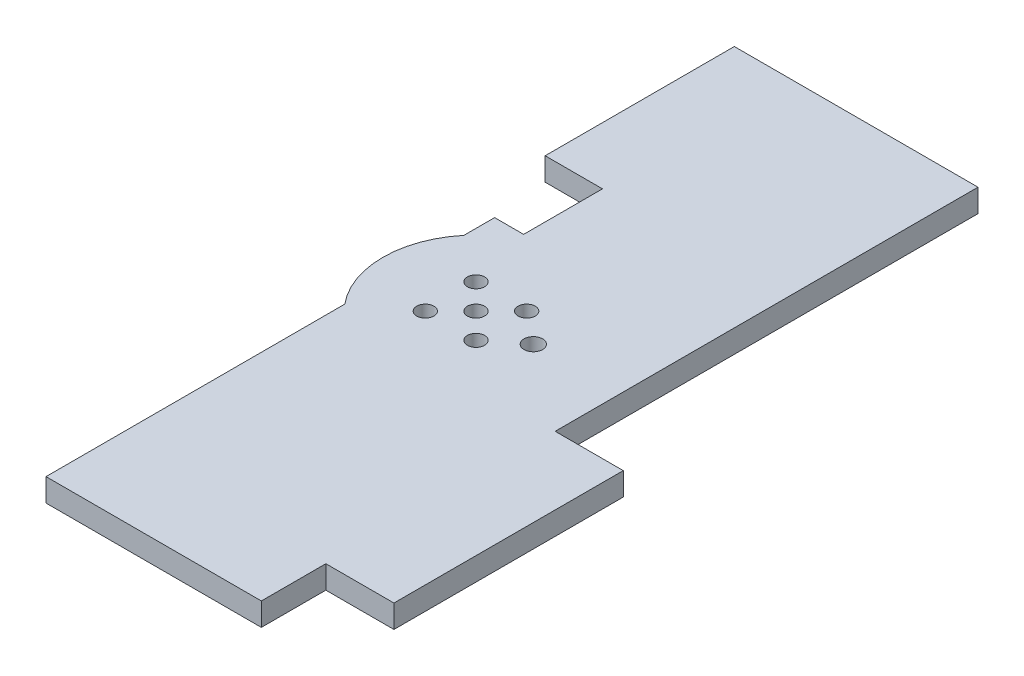
from build123d import *

# Parameters (mm, degrees)
BOSS_EXTRUDE1_DEPTH      = 1.6
M12_MOUNTING_HOLES_REACH = 33.9
SKETCH3_R                = 0.6
SKETCH3_R_2              = 0.65


with BuildPart() as part:
    # Sketch1 → Boss-Extrude1 (new body)
    with BuildSketch(Plane(origin=(0, 0, 0), x_dir=(1, 0, 0), z_dir=(0, 1, 0))):
        with BuildLine():
            Line((0, 25), (15, 25))
            Line((15, 25), (15, -4.499993736))
            Line((15, -4.499993736), (19.75, -4.499993736))
            Line((19.75, -4.499993736), (19.75, -20.499993736))
            Line((19.75, -20.499993736), (15, -20.499993736))
            Line((15, -20.499993736), (15, -24.999993736))
            Line((15, -24.999993736), (-0.025028863, -24.999993736))
            Line((-0.025028863, -24.999993736), (-0.025028863, -4.153311931))
            ThreePointArc((-0.025028863, -4.153311931), (-1.525028863, 0), (-0.025028863, 4.153311931))
            Line((-0.025028863, 4.153311931), (-0.025028863, 6.3))
            Line((-0.025028863, 6.3), (2, 6.3))
            Line((2, 6.3), (2, 11.8))
            Line((2, 11.8), (-2, 11.8))
            Line((-2, 11.8), (-2, 25))
            Line((-2, 25), (0, 25))
        make_face()
    extrude(amount=BOSS_EXTRUDE1_DEPTH)

    # Sketch3 → M12 mounting holes (cut, up to next)
    with BuildSketch(Plane(origin=(0, 1.6, 0), x_dir=(1, 0, 0), z_dir=(0, 1, 0)), mode=Mode.PRIVATE) as m12_mounting_holes_sk1:
        with Locations((4.974971137, 0)):
            Circle(SKETCH3_R)
    m12_mounting_holes_tool1 = extrude(m12_mounting_holes_sk1.sketch, amount=-M12_MOUNTING_HOLES_REACH, mode=Mode.PRIVATE) & part.part
    # Sketch3 → M12 mounting holes (cut, up to next)
    with BuildSketch(Plane(origin=(0, 1.6, 0), x_dir=(1, 0, 0), z_dir=(0, 1, 0)), mode=Mode.PRIVATE) as m12_mounting_holes_sk2:
        with Locations((3.207204184, 1.767766953)):
            Circle(SKETCH3_R)
    m12_mounting_holes_tool2 = extrude(m12_mounting_holes_sk2.sketch, amount=-M12_MOUNTING_HOLES_REACH, mode=Mode.PRIVATE) & part.part
    # Sketch3 → M12 mounting holes (cut, up to next)
    with BuildSketch(Plane(origin=(0, 1.6, 0), x_dir=(1, 0, 0), z_dir=(0, 1, 0)), mode=Mode.PRIVATE) as m12_mounting_holes_sk3:
        with Locations((6.74273809, 1.767766953)):
            Circle(SKETCH3_R)
    m12_mounting_holes_tool3 = extrude(m12_mounting_holes_sk3.sketch, amount=-M12_MOUNTING_HOLES_REACH, mode=Mode.PRIVATE) & part.part
    # Sketch3 → M12 mounting holes (cut, up to next)
    with BuildSketch(Plane(origin=(0, 1.6, 0), x_dir=(1, 0, 0), z_dir=(0, 1, 0)), mode=Mode.PRIVATE) as m12_mounting_holes_sk4:
        with Locations((6.74273809, -1.767766953)):
            Circle(SKETCH3_R)
    m12_mounting_holes_tool4 = extrude(m12_mounting_holes_sk4.sketch, amount=-M12_MOUNTING_HOLES_REACH, mode=Mode.PRIVATE) & part.part
    # Sketch3 → M12 mounting holes (cut, up to next)
    with BuildSketch(Plane(origin=(0, 1.6, 0), x_dir=(1, 0, 0), z_dir=(0, 1, 0)), mode=Mode.PRIVATE) as m12_mounting_holes_sk5:
        with Locations((3.207204184, -1.767766953)):
            Circle(SKETCH3_R)
    m12_mounting_holes_tool5 = extrude(m12_mounting_holes_sk5.sketch, amount=-M12_MOUNTING_HOLES_REACH, mode=Mode.PRIVATE) & part.part
    # Sketch3 → M12 mounting holes (cut, up to next)
    with BuildSketch(Plane(origin=(0, 1.6, 0), x_dir=(1, 0, 0), z_dir=(0, 1, 0)), mode=Mode.PRIVATE) as m12_mounting_holes_sk6:
        with Locations((8.974971137, 0)):
            Circle(SKETCH3_R_2)
    m12_mounting_holes_tool6 = extrude(m12_mounting_holes_sk6.sketch, amount=-M12_MOUNTING_HOLES_REACH, mode=Mode.PRIVATE) & part.part
    add(m12_mounting_holes_tool1.solids().sort_by_distance((4.974971, 1.6, 0))[0], mode=Mode.SUBTRACT)
    add(m12_mounting_holes_tool2.solids().sort_by_distance((3.207204, 1.6, -1.767767))[0], mode=Mode.SUBTRACT)
    add(m12_mounting_holes_tool3.solids().sort_by_distance((6.742738, 1.6, -1.767767))[0], mode=Mode.SUBTRACT)
    add(m12_mounting_holes_tool4.solids().sort_by_distance((6.742738, 1.6, 1.767767))[0], mode=Mode.SUBTRACT)
    add(m12_mounting_holes_tool5.solids().sort_by_distance((3.207204, 1.6, 1.767767))[0], mode=Mode.SUBTRACT)
    add(m12_mounting_holes_tool6.solids().sort_by_distance((8.974971, 1.6, 0))[0], mode=Mode.SUBTRACT)


solid = part.part
